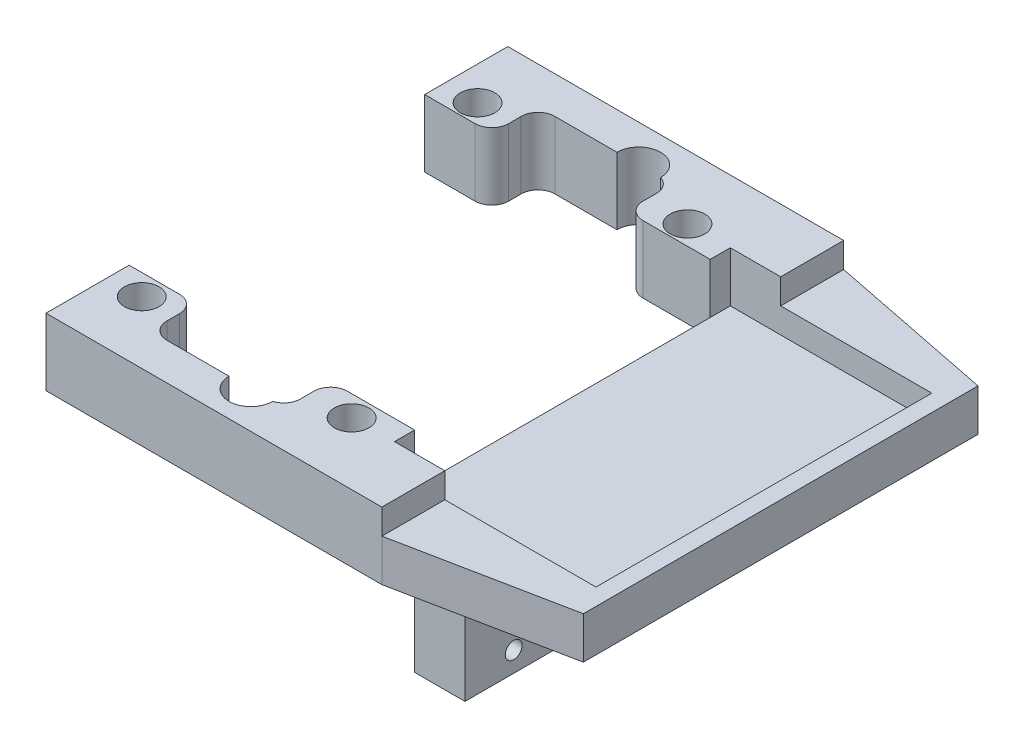
from build123d import *

# Parameters (mm, degrees)
SKETCH1_R           = 3.302
SKETCH1_R_2         = 2.615549664
BOSS_EXTRUDE1_DEPTH = 6.35
SKETCH2_W           = 30.48
SKETCH2_H           = 50.8
CUT_EXTRUDE1_DEPTH  = 3.81
CUT_EXTRUDE2_DEPTH  = 83.161835082
SKETCH13_R          = 2.615549664
BOSS_EXTRUDE7_DEPTH = 3.81
SKETCH15_W          = 7.62
SKETCH15_H          = 44.704
BOSS_EXTRUDE8_DEPTH = 21.59
SKETCH16_R          = 1.27
CUT_EXTRUDE3_DEPTH  = 81.375650193
FILLET1_R           = 2.54
CHAMFER2_SIZE       = 2.54


with BuildPart() as part:
    # Sketch1 → Boss-Extrude1 (new body)
    with BuildSketch(Plane(origin=(0, 0, 0), x_dir=(1, 0, 0), z_dir=(0, 1, 0))):
        Polygon((50.8, -0.508), (25.4, -5.588), (-25.4, -5.588), (-25.4, 64.262), (25.4, 64.262), (50.8, 59.182), align=None)
        with Locations(Location((0, 0, 0), (0, 0, 270))):
            Circle(SKETCH1_R, mode=Mode.SUBTRACT)
        with Locations(Location((0, 58.674, 0), (0, 0, 270))):
            Circle(SKETCH1_R, mode=Mode.SUBTRACT)
        with Locations(Location((11.43, 54.61, 0), (0, 0, 270))):
            Circle(SKETCH1_R_2, mode=Mode.SUBTRACT)
        with Locations(Location((-20.32, 54.61, 0), (0, 0, 270))):
            Circle(SKETCH1_R_2, mode=Mode.SUBTRACT)
        with Locations(Location((-20.32, 3.81, 0), (0, 0, 270))):
            Circle(SKETCH1_R_2, mode=Mode.SUBTRACT)
        with Locations(Location((11.43, 3.81, 0), (0, 0, 270))):
            Circle(SKETCH1_R_2, mode=Mode.SUBTRACT)
    extrude(amount=BOSS_EXTRUDE1_DEPTH)

    # Sketch2 → Cut-Extrude1 (cut)
    with BuildSketch(Plane(origin=(0, 6.35, 0), x_dir=(1, 0, 0), z_dir=(0, 1, 0))):
        with Locations((33.02, 29.337)):
            Rectangle(SKETCH2_W, SKETCH2_H)
    extrude(amount=-CUT_EXTRUDE1_DEPTH, mode=Mode.SUBTRACT)

    # Sketch3 → Cut-Extrude2 (cut, through all)
    with BuildSketch(Plane(origin=(0, 6.35, 0), x_dir=(1, 0, 0), z_dir=(0, 1, 0))):
        with BuildLine():
            Line((-15.24, 58.674), (-15.24, 51.689))
            Line((-15.24, 51.689), (5.08, 51.689))
            Line((5.08, 51.689), (5.08, 58.674))
            Line((5.08, 58.674), (3.302, 58.674))
            ThreePointArc((3.302, 58.674), (0, 55.372), (-3.302, 58.674))
            Line((-3.302, 58.674), (-15.24, 58.674))
        make_face()
        Polygon((-15.24, 51.689), (-25.4, 51.689), (-25.4, 6.985), (-15.24, 6.985), (5.08, 6.985), (17.78, 6.985), (17.78, 51.689), (5.08, 51.689), align=None)
        with BuildLine():
            Line((5.08, 6.985), (-15.24, 6.985))
            Line((-15.24, 6.985), (-15.24, 0))
            Line((-15.24, 0), (-3.302, 0))
            ThreePointArc((-3.302, 0), (0, 3.302), (3.302, 0))
            Line((3.302, 0), (5.08, 0))
            Line((5.08, 0), (5.08, 6.985))
        make_face()
    extrude(amount=-CUT_EXTRUDE2_DEPTH, mode=Mode.SUBTRACT)

    # Sketch13 → Boss-Extrude7 (add)
    # profile 1 of 2: a face of its own
    with BuildSketch(Plane(origin=(0, 6.35, 0), x_dir=(1, 0, 0), z_dir=(0, 1, 0))):
        with BuildLine():
            Line((-25.4, 64.262), (-25.4, 51.689))
            Line((-25.4, 51.689), (-15.24, 51.689))
            Line((-15.24, 51.689), (-15.24, 58.674))
            Line((-15.24, 58.674), (-3.302, 58.674))
            ThreePointArc((-3.302, 58.674), (0, 61.976), (3.302, 58.674))
            Line((3.302, 58.674), (5.08, 58.674))
            Line((5.08, 58.674), (5.08, 51.689))
            Line((5.08, 51.689), (17.78, 51.689))
            Line((17.78, 51.689), (17.78, 54.737))
            Line((17.78, 54.737), (25.4, 54.737))
            Line((25.4, 54.737), (25.4, 64.262))
            Line((25.4, 64.262), (-25.4, 64.262))
        make_face()
        with Locations(Location((-20.32, 54.61, 0), (0, 0, 270))):
            Circle(SKETCH13_R, mode=Mode.SUBTRACT)
        with Locations(Location((11.43, 54.61, 0), (0, 0, 270))):
            Circle(SKETCH13_R, mode=Mode.SUBTRACT)
    # profile 2 of 2: a face of its own
    with BuildSketch(Plane(origin=(0, 6.35, 0), x_dir=(1, 0, 0), z_dir=(0, 1, 0))):
        with BuildLine():
            Line((-15.24, 6.985), (-25.4, 6.985))
            Line((-25.4, 6.985), (-25.4, -5.588))
            Line((-25.4, -5.588), (25.4, -5.588))
            Line((25.4, -5.588), (25.4, 3.937))
            Line((25.4, 3.937), (17.78, 3.937))
            Line((17.78, 3.937), (17.78, 6.985))
            Line((17.78, 6.985), (5.08, 6.985))
            Line((5.08, 6.985), (5.08, 0))
            Line((5.08, 0), (3.302, 0))
            ThreePointArc((3.302, 0), (0, -3.302), (-3.302, 0))
            Line((-3.302, 0), (-15.24, 0))
            Line((-15.24, 0), (-15.24, 6.985))
        make_face()
        with Locations(Location((-20.32, 3.81, 0), (0, 0, 270))):
            Circle(SKETCH13_R, mode=Mode.SUBTRACT)
        with Locations(Location((11.43, 3.81, 0), (0, 0, 270))):
            Circle(SKETCH13_R, mode=Mode.SUBTRACT)
    extrude(amount=BOSS_EXTRUDE7_DEPTH)

    # Sketch15 → Boss-Extrude8 (add)
    with BuildSketch(Plane.XZ):
        with Locations((21.59, -29.337)):
            Rectangle(SKETCH15_W, SKETCH15_H)
    extrude(amount=BOSS_EXTRUDE8_DEPTH)

    # Sketch16 → Cut-Extrude3 (cut, through all)
    with BuildSketch(Plane.ZY.offset(-17.78)):
        with Locations((-44.323, -18.542)):
            Circle(SKETCH16_R)
        with Locations((-34.671, -18.542)):
            Circle(SKETCH16_R)
        with Locations((-24.003, -18.542)):
            Circle(SKETCH16_R)
        with Locations((-14.351, -18.542)):
            Circle(SKETCH16_R)
    extrude(amount=-CUT_EXTRUDE3_DEPTH, mode=Mode.SUBTRACT)

    # Fillet1
    # the kernel refuses this fillet: 2.54 mm, written as the material it adds along each edge
    with BuildSketch(Plane(origin=(-15.24, 0, -58.674), x_dir=(0, 0, 1), z_dir=(0, 1, 0))) as fillet1_piece_1:
        with BuildLine():
            CenterArc((FILLET1_R, FILLET1_R), FILLET1_R, 180, 90)
            Line((0, FILLET1_R), (0, 0))
            Line((0, 0), (FILLET1_R, 0))
        make_face()
    extrude(amount=10.16)
    with BuildSketch(Plane(origin=(5.08, 10.16, -58.674), x_dir=(-1, 0, 0), z_dir=(0, -1, 0))) as fillet1_piece_2:
        with BuildLine():
            CenterArc((2.54, -2.423005572), FILLET1_R, 107.457603124, 72.542396876)
            Line((0, -2.423005572), (0, 0))
            Line((0, 0), (1.778, 0))
        make_face()
    extrude(amount=10.16)
    with BuildSketch(Plane(origin=(5.08, 10.16, 0), x_dir=(0, 0, -1), z_dir=(0, -1, 0))) as fillet1_piece_3:
        with BuildLine():
            CenterArc((2.423005572, -2.54), FILLET1_R, 90, 72.542396876)
            Line((0, -1.778), (0, 0))
            Line((0, 0), (2.423005572, 0))
        make_face()
    extrude(amount=10.16)
    with BuildSketch(Plane(origin=(-15.24, 10.16, 0), x_dir=(1, 0, 0), z_dir=(0, -1, 0))) as fillet1_piece_4:
        with BuildLine():
            CenterArc((FILLET1_R, -FILLET1_R), FILLET1_R, 90, 90)
            Line((0, -FILLET1_R), (0, 0))
            Line((0, 0), (FILLET1_R, 0))
        make_face()
    extrude(amount=10.16)
    # the kernel refuses this fillet: 2.54 mm, written as the material it takes off along each edge
    with BuildSketch(Plane(origin=(-15.24, -6.35, -51.689), x_dir=(-1, 0, 0), z_dir=(0, 1, 0))) as fillet1_2_piece_1:
        with BuildLine():
            CenterArc((FILLET1_R, -FILLET1_R), FILLET1_R, 90, 90)
            Line((0, -FILLET1_R), (0, 0))
            Line((0, 0), (FILLET1_R, 0))
        make_face()
    extrude(amount=22.86, mode=Mode.SUBTRACT)
    with BuildSketch(Plane(origin=(5.08, 16.51, -51.689), x_dir=(0, 0, -1), z_dir=(0, -1, 0)), Plane(origin=(5.08, 16.51, -6.985), x_dir=(1, 0, 0), z_dir=(0, -1, 0)), Plane(origin=(-15.24, 16.51, -6.985), x_dir=(0, 0, 1), z_dir=(0, -1, 0))) as fillet1_2_piece_2:
        with BuildLine():
            CenterArc((FILLET1_R, FILLET1_R), FILLET1_R, 180, 90)
            Line((0, FILLET1_R), (0, 0))
            Line((0, 0), (FILLET1_R, 0))
        make_face()
    extrude(amount=22.86, mode=Mode.SUBTRACT)

    # Chamfer2
    chamfer2_edges = [part.edges().sort_by_distance(p)[0] for p in [
        (21.59, 0, -51.689),
        (25.4, 0, -29.337),
        (21.59, 0, -6.985),
    ]]
    chamfer(chamfer2_edges, length=CHAMFER2_SIZE)


solid = part.part
